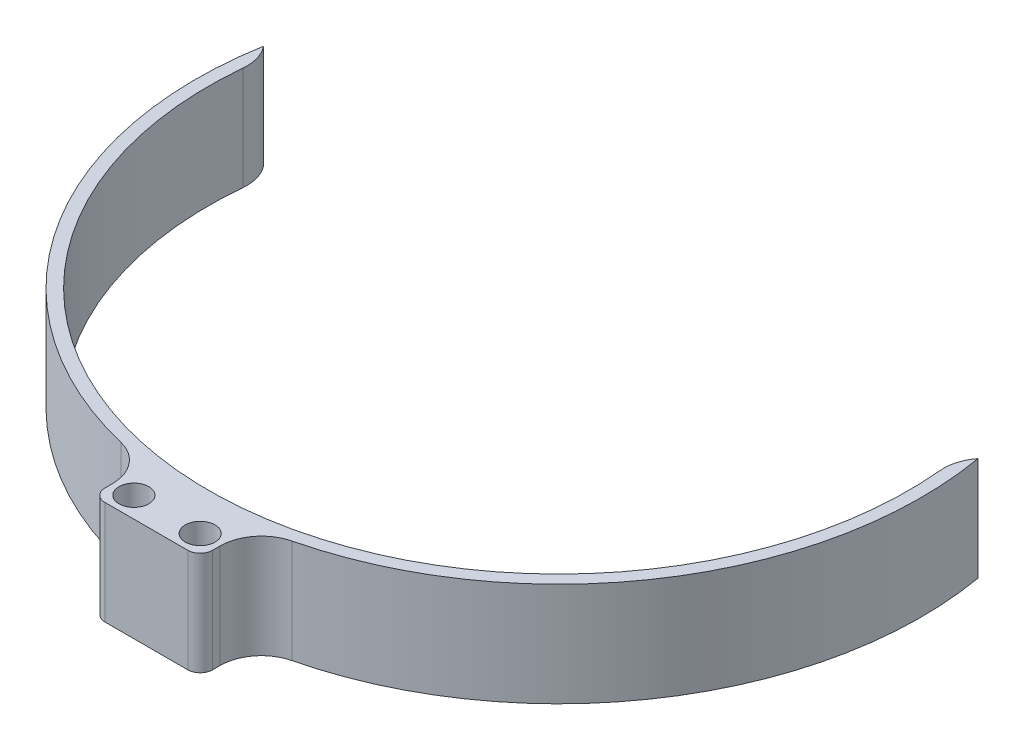
from build123d import *

# Parameters (mm, degrees)
SKETCH_1_R      = 3.6
SKETCH_1_R_2    = 2.3
EXTRUDE_1_DEPTH = 5
EXTRUDE_START   = 5
SKETCH_1_8_R    = 3.6
EXTRUDE_2_DEPTH = 20
FILLET_2_R      = 10
FILLET_3_R      = 3


with BuildPart() as part:
    # 草图1 → 凸台-拉伸1 (new body)
    # profile 1 of 5: a face of its own
    with BuildSketch(Plane(origin=(0, 0, 5), x_dir=(1, 0, 0), z_dir=(0, 1, 0))):
        with BuildLine():
            ThreePointArc((13, -81.528896907), (0, -82.5), (-13, -81.528896907))
            Line((-13, -81.528896907), (-13, -94.528896907))
            Line((-13, -94.528896907), (13, -94.528896907))
            Line((13, -94.528896907), (13, -81.528896907))
        make_face()
        with Locations((-8, -89.528896907)):
            Circle(SKETCH_1_R, mode=Mode.SUBTRACT)
        with Locations((8, -89.528896907)):
            Circle(SKETCH_1_R, mode=Mode.SUBTRACT)
    # profile 2 of 5: a face of its own
    with BuildSketch(Plane(origin=(0, 0, 5), x_dir=(1, 0, 0), z_dir=(0, 1, 0))):
        with BuildLine():
            ThreePointArc((-83.157982179, 20), (0, -79.5), (83.157982179, 20))
            Line((83.157982179, 20), (86.204698248, 20))
            ThreePointArc((86.204698248, 20), (0, -82.5), (-86.204698248, 20))
            Line((-86.204698248, 20), (-83.157982179, 20))
        make_face()
    # profile 3 of 5: a face of its own
    with BuildSketch(Plane(origin=(0, 0, 5), x_dir=(1, 0, 0), z_dir=(0, 1, 0))):
        with BuildLine():
            ThreePointArc((13, -81.528896907), (0, -82.5), (-13, -81.528896907))
            Line((-13, -81.528896907), (-13, -94.528896907))
            Line((-13, -94.528896907), (13, -94.528896907))
            Line((13, -94.528896907), (13, -81.528896907))
        make_face()
        with Locations((-8, -89.528896907)):
            Circle(SKETCH_1_R, mode=Mode.SUBTRACT)
        with Locations((8, -89.528896907)):
            Circle(SKETCH_1_R, mode=Mode.SUBTRACT)
    # profile 4 of 5: a face of its own
    with BuildSketch(Plane(origin=(0, 0, 5), x_dir=(1, 0, 0), z_dir=(0, 1, 0))):
        with Locations((-8, -89.528896907)):
            Circle(SKETCH_1_R)
        with Locations(Location((-8, -89.528896907, 0), (0, 0, 270))):
            Circle(SKETCH_1_R_2, mode=Mode.SUBTRACT)
    # profile 5 of 5: a face of its own
    with BuildSketch(Plane(origin=(0, 0, 5), x_dir=(1, 0, 0), z_dir=(0, 1, 0))):
        with Locations((8, -89.528896907)):
            Circle(SKETCH_1_R)
        with Locations(Location((8, -89.528896907, 0), (0, 0, 270))):
            Circle(SKETCH_1_R_2, mode=Mode.SUBTRACT)
    extrude(amount=EXTRUDE_1_DEPTH)

    # 草图1<8> → 凸台-拉伸2 (add)
    # profile 1 of 3: a face of its own
    with BuildSketch(Plane(origin=(0, 0, 5), x_dir=(1, 0, 0), z_dir=(0, 1, 0)).offset(EXTRUDE_START)):
        with BuildLine():
            ThreePointArc((13, -81.528896907), (0, -82.5), (-13, -81.528896907))
            Line((-13, -81.528896907), (-13, -94.528896907))
            Line((-13, -94.528896907), (13, -94.528896907))
            Line((13, -94.528896907), (13, -81.528896907))
        make_face()
        with Locations(Location((-8, -89.528896907, 0), (0, 0, 270))):
            Circle(SKETCH_1_8_R, mode=Mode.SUBTRACT)
        with Locations(Location((8, -89.528896907, 0), (0, 0, 270))):
            Circle(SKETCH_1_8_R, mode=Mode.SUBTRACT)
    # profile 2 of 3: a face of its own
    with BuildSketch(Plane(origin=(0, 0, 5), x_dir=(1, 0, 0), z_dir=(0, 1, 0)).offset(EXTRUDE_START)):
        with BuildLine():
            ThreePointArc((-83.157982179, 20), (0, -79.5), (83.157982179, 20))
            Line((83.157982179, 20), (86.204698248, 20))
            ThreePointArc((86.204698248, 20), (0, -82.5), (-86.204698248, 20))
            Line((-86.204698248, 20), (-83.157982179, 20))
        make_face()
    # profile 3 of 3: a face of its own
    with BuildSketch(Plane(origin=(0, 0, 5), x_dir=(1, 0, 0), z_dir=(0, 1, 0)).offset(EXTRUDE_START)):
        with BuildLine():
            ThreePointArc((13, -81.528896907), (0, -82.5), (-13, -81.528896907))
            Line((-13, -81.528896907), (-13, -94.528896907))
            Line((-13, -94.528896907), (13, -94.528896907))
            Line((13, -94.528896907), (13, -81.528896907))
        make_face()
        with Locations(Location((-8, -89.528896907, 0), (0, 0, 270))):
            Circle(SKETCH_1_8_R, mode=Mode.SUBTRACT)
        with Locations(Location((8, -89.528896907, 0), (0, 0, 270))):
            Circle(SKETCH_1_8_R, mode=Mode.SUBTRACT)
    extrude(amount=EXTRUDE_2_DEPTH)

    # 圆角2
    # the kernel refuses this fillet: 10 mm, written as the material it adds along each edge
    with BuildSketch(Plane(origin=(13, 25, 86.528896907), x_dir=(0, 0, 1), z_dir=(0, -1, 0))) as fillet_2_piece_1:
        with BuildLine():
            CenterArc((8.219454002, -10), FILLET_2_R, 90, 76.355470557)
            ThreePointArc((-1.498325579, -7.641025641), (-0.664124715, -3.837187901), (0, 0))
            Line((0, 0), (8.219454002, 0))
        make_face()
    extrude(amount=25)
    with BuildSketch(Plane(origin=(-13, 25, 86.528896907), x_dir=(-0.9813116821933555, 0, -0.1924250045884026), z_dir=(0, -1, 0))) as fillet_2_piece_2:
        with BuildLine():
            CenterArc((8.231488348, -9.990096279), FILLET_2_R, 92.550190808, 76.355470557)
            Line((-1.581628474, -8.065846233), (0, 0))
            ThreePointArc((0, 0), (3.893271516, -0.086657558), (7.786543032, 0))
        make_face()
    extrude(amount=25)
    # the kernel refuses this fillet: 10 mm, written as the material it takes off along each edge
    with BuildSketch(Plane(origin=(-83.157982179, -17.895247065, -15), x_dir=(-0.13567256273252146, 0, 0.9907537311166635), z_dir=(0, 1, 0))) as fillet_2_2_piece_1:
        with BuildLine():
            CenterArc((7.581654969, -9.991025983), FILLET_2_R, 92.427524139, 43.365844963)
            Line((0.413355777, -3.018545313), (0, 0))
            ThreePointArc((0, 0), (3.579049413, -0.075830444), (7.158098826, 0))
        make_face()
    extrude(amount=60.790494129, mode=Mode.SUBTRACT)
    with BuildSketch(Plane(origin=(83.157982179, -17.895247065, -15), x_dir=(1, 0, 0), z_dir=(0, 1, 0))) as fillet_2_2_piece_2:
        with BuildLine():
            CenterArc((10.92726883, -6.15604485), FILLET_2_R, 142.004143618, 43.365844963)
            ThreePointArc((0.971157612, -7.091913119), (0.560708101, -3.535668449), (0, 0))
            Line((0, 0), (3.046716069, 0))
        make_face()
    extrude(amount=60.790494129, mode=Mode.SUBTRACT)

    # 圆角3
    fillet_3_edges = [part.edges().sort_by_distance(p)[0] for p in [
        (13, 12.5, 99.528896907),
        (-13, 12.5, 99.528896907),
    ]]
    fillet(fillet_3_edges, radius=FILLET_3_R)


solid = part.part
